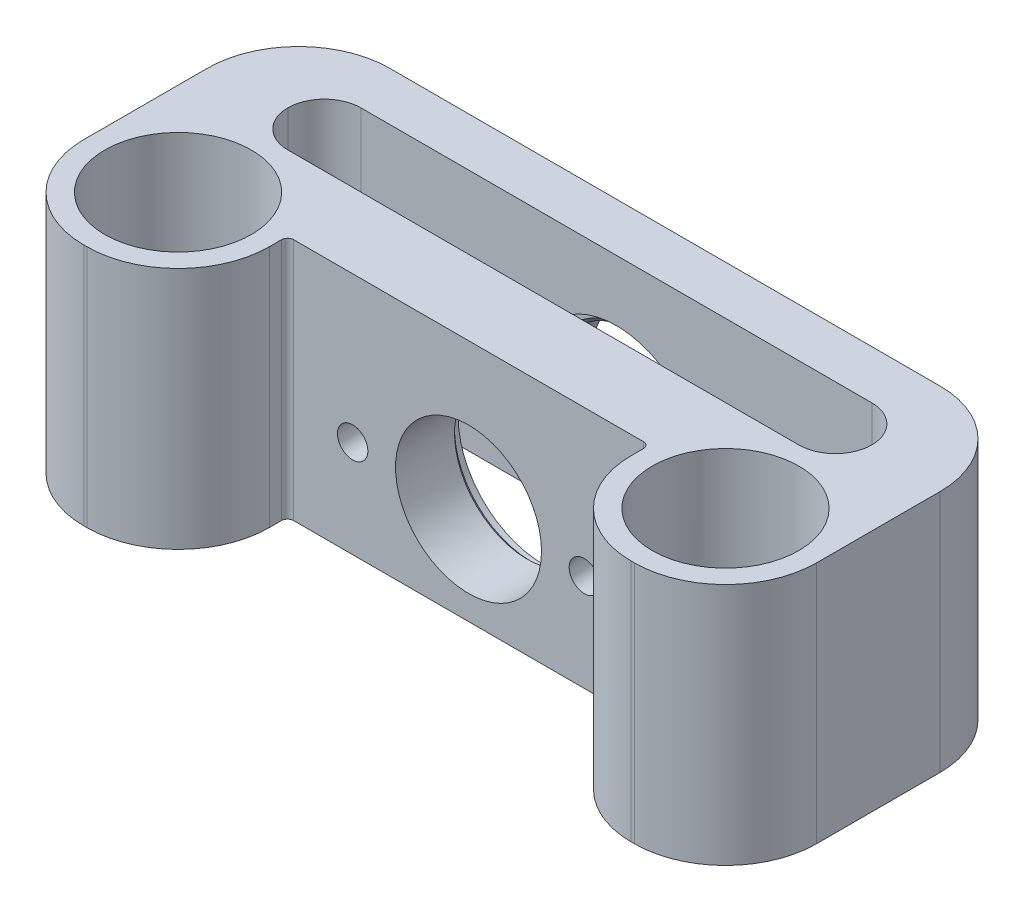
from build123d import *

# Parameters (mm, degrees)
ESQUISSE2_W                         = 60.25
ESQUISSE2_H                         = 20
BOSS_EXTRU_2_DEPTH                  = 25.15
ESQUISSE3_W                         = 29.75
ESQUISSE3_H                         = 20
ENL_V_MAT_EXTRU_1_DEPTH             = 9
ESQUISSE4_W                         = 48
ESQUISSE4_H                         = 6
ENL_V_MAT_EXTRU_2_DEPTH             = 45.045863881
ESQUISSE5_R                         = 6
ENL_V_MAT_EXTRU_3_DEPTH             = 36.613735061
ENL_V_START                         = -1
ESQUISSE6_R                         = 7
ENL_V_MAT_EXTRU_4_DEPTH             = 8
ESQUISSE7_R                         = 6.025
ENL_V_MAT_EXTRU_5_DEPTH             = 45.045863881
CONG_1_R                            = 7.5
CONG_2_R                            = 0.5
DIAM_TRE_DU_PER_AGE_2_5_2_5_1_D     = 2.5
DIAM_TRE_DU_PER_AGE_2_5_2_5_1_DEPTH = 6.15
CONG_4_R                            = 3
BOSS_EXTRU_3_START                  = -1
ESQUISSE11_R                        = 6.025
ESQUISSE11_R_2                      = 4
BOSS_EXTRU_3_DEPTH                  = 1
CHANFREIN2_SIZE                     = 0.3


with BuildPart() as part:
    # Esquisse2 → Boss.-Extru.2 (new body)
    with BuildSketch(Plane.XY):
        Rectangle(ESQUISSE2_W, ESQUISSE2_H)
    extrude(amount=BOSS_EXTRU_2_DEPTH)

    # Esquisse3 → Enlèv. mat.-Extru.1 (cut)
    with BuildSketch(Plane.XY.offset(25.15)):
        Rectangle(ESQUISSE3_W, ESQUISSE3_H)
    extrude(amount=-ENL_V_MAT_EXTRU_1_DEPTH, mode=Mode.SUBTRACT)

    # Esquisse4 → Enlèv. mat.-Extru.2 (cut, through all)
    with BuildSketch(Plane(origin=(0, 10, 0), x_dir=(1, 0, 0), z_dir=(0, 1, 0))):
        with Locations((0, -7)):
            Rectangle(ESQUISSE4_W, ESQUISSE4_H)
    extrude(amount=-ENL_V_MAT_EXTRU_2_DEPTH, mode=Mode.SUBTRACT)

    # Esquisse5 → Enlèv. mat.-Extru.3 (cut, through all)
    with BuildSketch(Plane.XY.offset(16.15)):
        with Locations((0, -2)):
            Circle(ESQUISSE5_R)
    extrude(amount=-ENL_V_MAT_EXTRU_3_DEPTH, mode=Mode.SUBTRACT)

    # Esquisse6 → Enlèv. mat.-Extru.4 (cut)
    with BuildSketch(Plane.XY.offset(4).offset(ENL_V_START)):
        with Locations(Location((0, -2, 0), (0, 0, 180))):
            Circle(ESQUISSE6_R)
    extrude(amount=ENL_V_MAT_EXTRU_4_DEPTH, mode=Mode.SUBTRACT)

    # Esquisse7 → Enlèv. mat.-Extru.5 (cut, through all)
    with BuildSketch(Plane(origin=(0, 10, 0), x_dir=(1, 0, 0), z_dir=(0, 1, 0))):
        with Locations(Location((-22.5, -17.525, 0), (0, 0, 270))):
            Circle(ESQUISSE7_R)
        with Locations(Location((22.5, -17.525, 0), (0, 0, 270))):
            Circle(ESQUISSE7_R)
    extrude(amount=-ENL_V_MAT_EXTRU_5_DEPTH, mode=Mode.SUBTRACT)

    # Congé1
    cong_1_edges = [part.edges().sort_by_distance(p)[0] for p in [
        (-30.125, 0, 25.15),
        (14.875, 0, 25.15),
        (-14.875, 0, 25.15),
        (-30.125, 0, 0),
        (30.125, 0, 0),
        (30.125, 0, 25.15),
    ]]
    fillet(cong_1_edges, radius=CONG_1_R)

    # Congé2
    cong_2_edges = [part.edges().sort_by_distance(p)[0] for p in [
        (14.875, 0, 16.15),
        (-14.875, 0, 16.15),
    ]]
    fillet(cong_2_edges, radius=CONG_2_R)

    # Diamètre du perçage Ø2.5 (2.5)1
    with Locations(Plane.XY.offset(16.15)):
        with Locations((-9.525, -2), (9.525, -2)):
            Hole(DIAM_TRE_DU_PER_AGE_2_5_2_5_1_D / 2, depth=DIAM_TRE_DU_PER_AGE_2_5_2_5_1_DEPTH)

    # Congé4
    cong_4_edges = [part.edges().sort_by_distance(p)[0] for p in [
        (-24, 0, 10),
        (-24, 0, 4),
        (24, 0, 4),
        (24, 0, 10),
    ]]
    fillet(cong_4_edges, radius=CONG_4_R - 0.0001)  # a hair under: the kernel refuses the full size

    # Esquisse11 → Boss.-Extru.3 (add)
    # profile 1 of 2: a face of its own
    with BuildSketch(Plane.XZ.offset(10).offset(BOSS_EXTRU_3_START)):
        with Locations(Location((22.5, 17.525, 0), (0, 0, 90))):
            Circle(ESQUISSE11_R)
        with Locations(Location((22.5, 17.525, 0), (0, 0, 270))):
            Circle(ESQUISSE11_R_2, mode=Mode.SUBTRACT)
    # profile 2 of 2: a face of its own
    with BuildSketch(Plane.XZ.offset(10).offset(BOSS_EXTRU_3_START)):
        with Locations(Location((-22.5, 17.525, 0), (0, 0, 90))):
            Circle(ESQUISSE11_R)
        with Locations(Location((-22.5, 17.525, 0), (0, 0, 270))):
            Circle(ESQUISSE11_R_2, mode=Mode.SUBTRACT)
    extrude(amount=BOSS_EXTRU_3_DEPTH)

    # Chanfrein2
    chanfrein2_edges = [part.edges().sort_by_distance(p)[0] for p in [
        (-6, -2, 11),
        (-6, -2, 3),
    ]]
    chamfer(chanfrein2_edges, length=CHANFREIN2_SIZE)


solid = part.part
